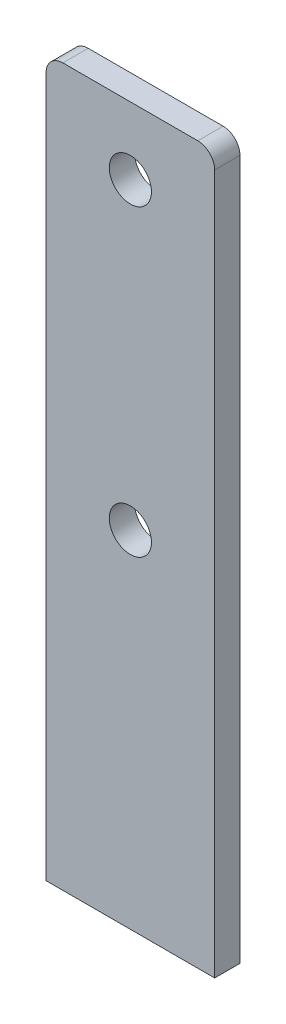
from build123d import *

# Parameters (mm, degrees)
CROQUIS1_R              = 2.5
SALIENTE_EXTRUIR1_DEPTH = 3


with BuildPart() as part:
    # Croquis1 → Saliente-Extruir1 (new body)
    with BuildSketch(Plane.XY):
        with BuildLine():
            Line((20, 0), (20, 83))
            ThreePointArc((20, 83), (19.414213562, 84.414213562), (18, 85))
            Line((18, 85), (2, 85))
            ThreePointArc((2, 85), (0.585786438, 84.414213562), (0, 83))
            Line((0, 83), (0, 0))
            Line((0, 0), (20, 0))
        make_face()
        with Locations((10, 41)):
            Circle(CROQUIS1_R, mode=Mode.SUBTRACT)
        with Locations((10, 77)):
            Circle(CROQUIS1_R, mode=Mode.SUBTRACT)
    extrude(amount=SALIENTE_EXTRUIR1_DEPTH)


solid = part.part
